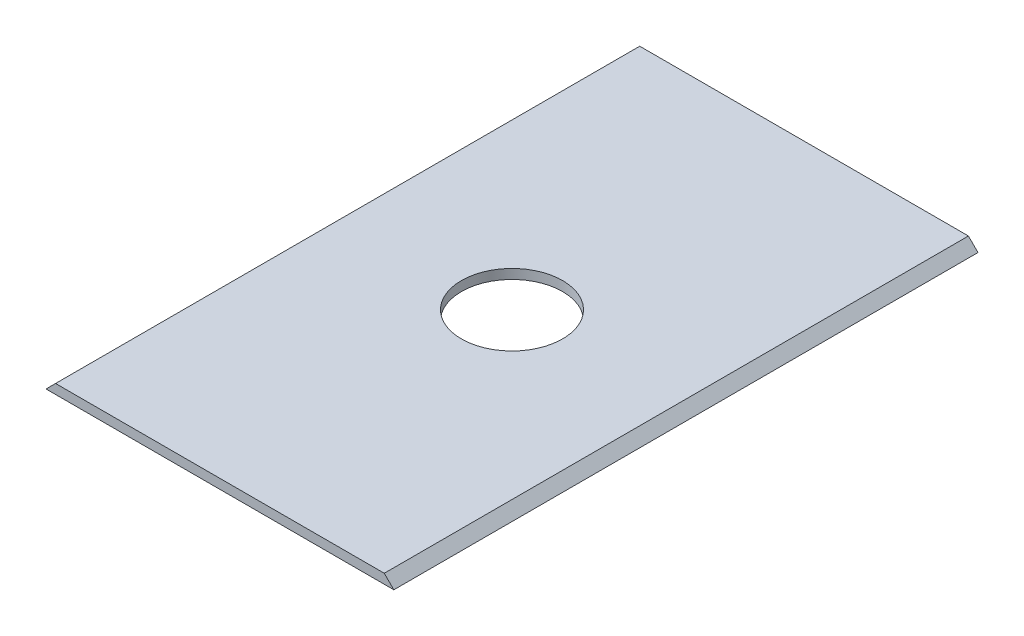
from build123d import *

# Parameters (mm, degrees)
BOSS_EXTRUDE1_DEPTH = 110
SKETCH2_R           = 9.525
CUT_EXTRUDE1_DEPTH  = 129.037064946


with BuildPart() as part:
    # Sketch1 → Boss-Extrude1 (new body)
    with BuildSketch(Plane.XY):
        Polygon((0, 0), (65.5, 0), (63.7, 1.8), (1.8, 1.8), align=None)
    extrude(amount=BOSS_EXTRUDE1_DEPTH)

    # Sketch2 → Cut-Extrude1 (cut, through all)
    with BuildSketch(Plane(origin=(0, 1.8, 0), x_dir=(1, 0, 0), z_dir=(0, 1, 0))):
        with Locations((32.75, -55)):
            Circle(SKETCH2_R)
    extrude(amount=-CUT_EXTRUDE1_DEPTH, mode=Mode.SUBTRACT)


solid = part.part
